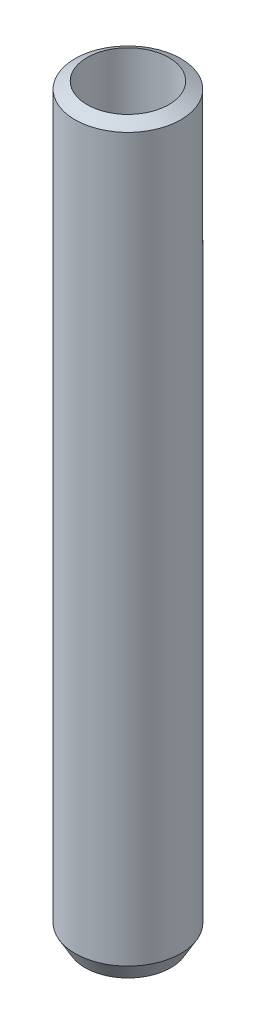
from build123d import *

# Parameters (mm, degrees)
SKETCH1_R           = 15
BOSS_EXTRUDE1_DEPTH = 212.271156
SKETCH2_R           = 11.570630693
CUT_EXTRUDE1_DEPTH  = 214.328487712
CHAMFER1_SIZE       = 2.843805
CHAMFER1_SIZE_2     = 4.925615


with BuildPart() as part:
    # Sketch1 → Boss-Extrude1 (new body)
    with BuildSketch(Plane(origin=(0, 0, 0), x_dir=(1, 0, 0), z_dir=(0, 1, 0))):
        with Locations(Location((0, 0, 0), (0, 0, 270))):
            Circle(SKETCH1_R)
    extrude(amount=BOSS_EXTRUDE1_DEPTH)

    # Sketch2 → Cut-Extrude1 (cut, through all)
    with BuildSketch(Plane(origin=(0, 0, 0), x_dir=(1, 0, 0), z_dir=(0, 1, 0))):
        with Locations(Location((0, 0, 0), (0, 0, 270))):
            Circle(SKETCH2_R)
    extrude(amount=CUT_EXTRUDE1_DEPTH, mode=Mode.SUBTRACT)

    # Chamfer1
    # the kernel refuses this chamfer: 4.925615, 2.843805 mm, written as the material it takes off along each edge
    with BuildSketch(Plane(origin=(0, 212.271156, 0), x_dir=(0, 0, 1), z_dir=(-1, 0, 0))) as chamfer1_piece_1:
        Polygon((15, -CHAMFER1_SIZE), (15 - CHAMFER1_SIZE_2, 0), (15, 0), align=None)
    revolve(axis=Axis((0, 212.271156, 0), (0, 1, 0)), mode=Mode.SUBTRACT)
    with BuildSketch(Plane(origin=(0, 0, 0), x_dir=(0, 0, 1), z_dir=(-1, 0, 0))) as chamfer1_piece_2:
        Polygon((15, CHAMFER1_SIZE_2), (15 - CHAMFER1_SIZE, 0), (15, 0), align=None)
    revolve(axis=Axis((0, 0, 0), (0, 1, 0)), mode=Mode.SUBTRACT)


solid = part.part
